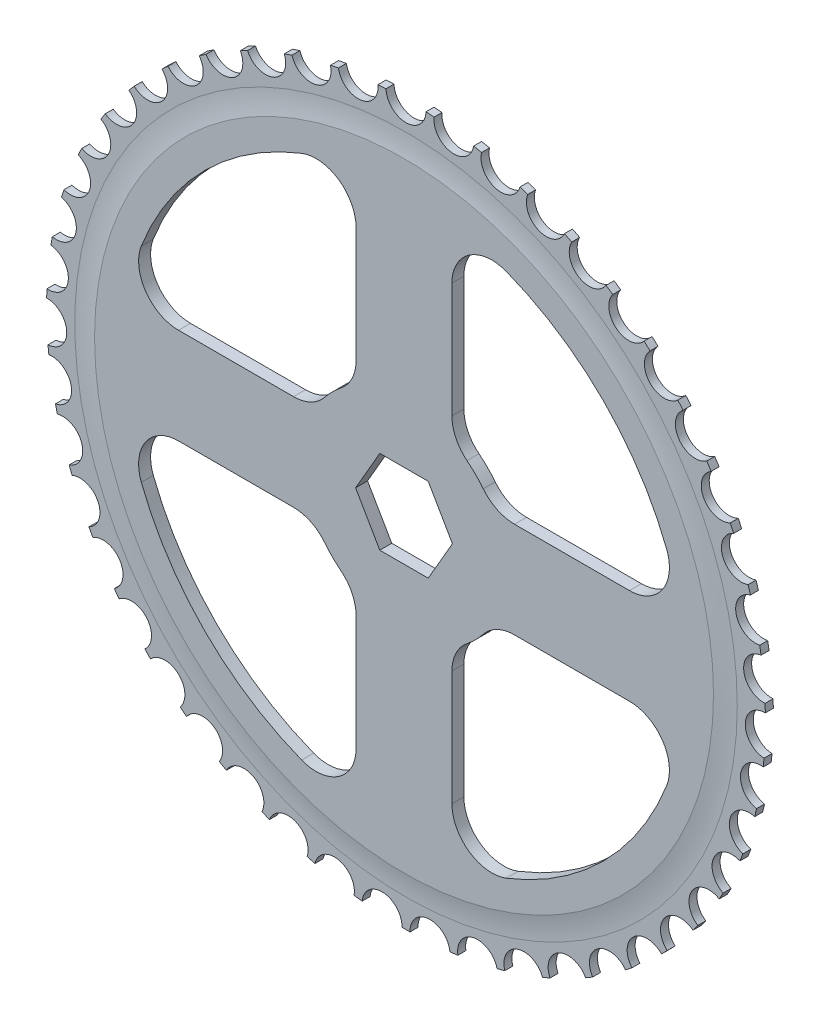
from build123d import *

# Parameters (mm, degrees)
BOSS_EXTRUDE1_DEPTH  = 1.5
CUT_EXTRUDE1_DEPTH   = 128.29897743
SKETCH3_R            = 116.459539932
SKETCH3_R_2          = 77.5
CUT_EXTRUDE2_DEPTH   = 0.5
FILLET1_R            = 30
FILLET1_OF_MIRROR1_R = 30


with BuildPart() as part:
    # Sketch1 → Boss-Extrude1 (new, symmetric)
    with BuildSketch(Plane.XY):
        with BuildLine():
            ThreePointArc((-4.998070615, 89.861111111), (-6.011337037, 89.799019076), (-7.023838635, 89.725501898))
            ThreePointArc((-7.023838635, 89.725501898), (-11.329391207, 84.241586493), (-16.930789178, 88.393146668))
            ThreePointArc((-16.930789178, 88.393146668), (-17.926738659, 88.196553453), (-18.920407319, 87.988738978))
            ThreePointArc((-18.920407319, 87.988738978), (-22.456609159, 81.97987988), (-28.561377406, 85.347804428))
            ThreePointArc((-28.561377406, 85.347804428), (-29.522237206, 85.020218245), (-30.479340886, 84.681814926))
            ThreePointArc((-30.479340886, 84.681814926), (-33.183088389, 78.255240367), (-39.682287178, 80.779428596))
            ThreePointArc((-39.682287178, 80.779428596), (-40.590910729, 80.326695227), (-41.494369893, 79.863741881))
            ThreePointArc((-41.494369893, 79.863741881), (-43.31741462, 73.134134237), (-50.095065595, 74.769541948))
            ThreePointArc((-50.095065595, 74.769541948), (-50.93523849, 74.199740431), (-51.768930886, 73.620498469))
            ThreePointArc((-51.768930886, 73.620498469), (-52.678740562, 66.707947749), (-59.61389638, 67.425391052))
            ThreePointArc((-59.61389638, 67.425391052), (-60.370625713, 66.748689508), (-61.119674081, 66.063495519))
            ThreePointArc((-61.119674081, 66.063495519), (-61.10001313, 59.091356352), (-68.068915771, 58.878032455))
            ThreePointArc((-68.068915771, 58.878032455), (-68.728697689, 58.10650664), (-69.379735245, 57.327587926))
            ThreePointArc((-69.379735245, 57.327587926), (-68.430954516, 50.420278302), (-75.309243748, 49.279993974))
            ThreePointArc((-75.309243748, 49.279993974), (-75.860304428, 48.427411785), (-76.401713389, 47.568668168))
            ThreePointArc((-76.401713389, 47.568668168), (-74.540743898, 40.849449191), (-81.205676486, 38.802552833))
            ThreePointArc((-81.205676486, 38.802552833), (-81.638182236, 37.884128619), (-82.060301147, 36.9608844))
            ThreePointArc((-82.060301147, 36.9608844), (-79.320351939, 30.549660691), (-85.652992004, 27.632679218))
            ThreePointArc((-85.652992004, 27.632679218), (-85.959224749, 26.66480228), (-86.254520888, 25.693532774))
            ThreePointArc((-86.254520888, 25.693532774), (-82.68448642, 19.704712773), (-88.57182785, 15.969699788))
            ThreePointArc((-88.57182785, 15.969699788), (-88.746322859, 14.969641912), (-88.90952666, 13.967679447))
            ThreePointArc((-88.90952666, 13.967679447), (-84.573114283, 8.508133788), (-89.91009733, 4.021740686))
            ThreePointArc((-89.91009733, 4.021740686), (-89.949740736, 3.007347931), (-89.977939822, 1.99257255))
            ThreePointArc((-89.977939822, 1.99257255), (-84.952532917, -2.840273046), (-89.643918993, -7.997986473))
            ThreePointArc((-89.643918993, -7.997986473), (-89.548003358, -9.008612246), (-89.440694517, -10.018091852))
            ThreePointArc((-89.440694517, -10.018091852), (-83.815971589, -14.13799514), (-87.778042798, -19.874989374))
            ThreePointArc((-87.778042798, -19.874989374), (-87.548279739, -20.863813524), (-87.307377899, -21.849983167))
            ThreePointArc((-87.307377899, -21.849983167), (-81.183712263, -25.183424375), (-84.345765349, -31.397322619))
            ThreePointArc((-84.345765349, -31.397322619), (-83.986254994, -32.346699555), (-83.616059054, -33.291961016))
            ThreePointArc((-83.616059054, -33.291961016), (-77.102727667, -35.779454806), (-79.40833572, -42.359369899))
            ThreePointArc((-79.40833572, -42.359369899), (-78.925493539, -43.252357967), (-78.432609654, -44.139843031))
            ThreePointArc((-78.432609654, -44.139843031), (-71.64584307, -45.737000019), (-73.053862458, -52.565513218))
            ThreePointArc((-73.053862458, -52.565513218), (-72.456304781, -53.386177026), (-71.849528478, -54.200048501))
            ThreePointArc((-71.849528478, -54.200048501), (-64.910436707, -54.878367382), (-65.395741291, -61.833623709))
            ThreePointArc((-65.395741291, -61.833623709), (-64.694131549, -62.567318491), (-63.984290763, -63.293052822))
            ThreePointArc((-63.984290763, -63.293052822), (-57.016702062, -63.04042898), (-56.570631571, -69.99831172))
            ThreePointArc((-56.570631571, -69.99831172), (-55.777490006, -70.631944675), (-54.977251864, -71.256591116))
            ThreePointArc((-54.977251864, -71.256591116), (-48.105503018, -70.077532629), (-46.73601759, -76.913878201))
            ThreePointArc((-46.73601759, -76.913878201), (-45.865497833, -77.436142133), (-44.989142602, -77.948553854))
            ThreePointArc((-44.989142602, -77.948553854), (-38.335860133, -75.864101048), (-36.067398268, -82.456914702))
            ThreePointArc((-36.067398268, -82.456914702), (-35.135034765, -82.858489801), (-34.198201026, -83.249522801))
            ThreePointArc((-34.198201026, -83.249522801), (-27.882112916, -80.296872787), (-24.755155369, -86.528505607))
            ThreePointArc((-24.755155369, -86.528505607), (-23.777586168, -86.802225755), (-22.796991741, -87.064902042))
            ThreePointArc((-22.796991741, -87.064902042), (-16.930808734, -83.296744928), (-13.001156137, -89.05599328))
            ThreePointArc((-13.001156137, -89.05599328), (-11.995825984, -89.196973934), (-10.988969599, -89.326606043))
            ThreePointArc((-10.988969599, -89.326606043), (-5.677373868, -84.810184683), (-1.015150965, -89.994274643))
            ThreePointArc((-1.015150965, -89.994274643), (0, -90), (1.015150965, -89.994274643))
            ThreePointArc((1.015150965, -89.994274643), (5.677373868, -84.810184683), (10.988969599, -89.326606043))
            ThreePointArc((10.988969599, -89.326606043), (11.995825984, -89.196973934), (13.001156137, -89.05599328))
            ThreePointArc((13.001156137, -89.05599328), (16.930808734, -83.296744928), (22.796991741, -87.064902042))
            ThreePointArc((22.796991741, -87.064902042), (23.777586168, -86.802225755), (24.755155369, -86.528505607))
            ThreePointArc((24.755155369, -86.528505607), (27.882112916, -80.296872787), (34.198201026, -83.249522801))
            ThreePointArc((34.198201026, -83.249522801), (35.135034765, -82.858489801), (36.067398268, -82.456914702))
            ThreePointArc((36.067398268, -82.456914702), (38.335860133, -75.864101048), (44.989142602, -77.948553854))
            ThreePointArc((44.989142602, -77.948553854), (45.865497833, -77.436142133), (46.73601759, -76.913878201))
            ThreePointArc((46.73601759, -76.913878201), (48.105503018, -70.077532629), (54.977251864, -71.256591116))
            ThreePointArc((54.977251864, -71.256591116), (55.777490006, -70.631944675), (56.570631571, -69.99831172))
            ThreePointArc((56.570631571, -69.99831172), (57.016702062, -63.04042898), (63.984290763, -63.293052822))
            ThreePointArc((63.984290763, -63.293052822), (64.694131549, -62.567318491), (65.395741291, -61.833623709))
            ThreePointArc((65.395741291, -61.833623709), (64.910436707, -54.878367382), (71.849528478, -54.200048501))
            ThreePointArc((71.849528478, -54.200048501), (72.456304781, -53.386177026), (73.053862458, -52.565513218))
            ThreePointArc((73.053862458, -52.565513218), (71.64584307, -45.737000019), (78.432609654, -44.139843031))
            ThreePointArc((78.432609654, -44.139843031), (78.925493539, -43.252357967), (79.40833572, -42.359369899))
            ThreePointArc((79.40833572, -42.359369899), (77.102727667, -35.779454806), (83.616059054, -33.291961016))
            ThreePointArc((83.616059054, -33.291961016), (83.986254994, -32.346699555), (84.345765349, -31.397322619))
            ThreePointArc((84.345765349, -31.397322619), (81.183712263, -25.183424375), (87.307377899, -21.849983167))
            ThreePointArc((87.307377899, -21.849983167), (87.548279739, -20.863813524), (87.778042798, -19.874989374))
            ThreePointArc((87.778042798, -19.874989374), (83.815971589, -14.13799514), (89.440694517, -10.018091852))
            ThreePointArc((89.440694517, -10.018091852), (89.548003358, -9.008612246), (89.643918993, -7.997986473))
            ThreePointArc((89.643918993, -7.997986473), (84.952532917, -2.840273046), (89.977939822, 1.99257255))
            ThreePointArc((89.977939822, 1.99257255), (89.949740736, 3.007347931), (89.91009733, 4.021740686))
            ThreePointArc((89.91009733, 4.021740686), (84.573114283, 8.508133788), (88.90952666, 13.967679447))
            ThreePointArc((88.90952666, 13.967679447), (88.746322859, 14.969641912), (88.57182785, 15.969699788))
            ThreePointArc((88.57182785, 15.969699788), (82.68448642, 19.704712773), (86.254520888, 25.693532774))
            ThreePointArc((86.254520888, 25.693532774), (85.959224749, 26.66480228), (85.652992004, 27.632679218))
            ThreePointArc((85.652992004, 27.632679218), (79.320351939, 30.549660691), (82.060301147, 36.9608844))
            ThreePointArc((82.060301147, 36.9608844), (81.638182236, 37.884128619), (81.205676486, 38.802552833))
            ThreePointArc((81.205676486, 38.802552833), (74.540743898, 40.849449191), (76.401713389, 47.568668168))
            ThreePointArc((76.401713389, 47.568668168), (75.860304428, 48.427411785), (75.309243748, 49.279993974))
            ThreePointArc((75.309243748, 49.279993974), (68.430954516, 50.420278302), (69.379735245, 57.327587926))
            ThreePointArc((69.379735245, 57.327587926), (68.728697689, 58.10650664), (68.068915771, 58.878032455))
            ThreePointArc((68.068915771, 58.878032455), (61.10001313, 59.091356352), (61.119674081, 66.063495519))
            ThreePointArc((61.119674081, 66.063495519), (60.370625713, 66.748689508), (59.61389638, 67.425391052))
            ThreePointArc((59.61389638, 67.425391052), (52.678740562, 66.707947749), (51.768930886, 73.620498469))
            ThreePointArc((51.768930886, 73.620498469), (50.93523849, 74.199740431), (50.095065595, 74.769541948))
            ThreePointArc((50.095065595, 74.769541948), (43.31741462, 73.134134237), (41.494369893, 79.863741881))
            ThreePointArc((41.494369893, 79.863741881), (40.590910729, 80.326695227), (39.682287178, 80.779428596))
            ThreePointArc((39.682287178, 80.779428596), (33.183088389, 78.255240367), (30.479340886, 84.681814926))
            ThreePointArc((30.479340886, 84.681814926), (29.522237206, 85.020218245), (28.561377406, 85.347804428))
            ThreePointArc((28.561377406, 85.347804428), (22.456609159, 81.97987988), (18.920407319, 87.988738978))
            ThreePointArc((18.920407319, 87.988738978), (17.926738659, 88.196553453), (16.930789178, 88.393146668))
            ThreePointArc((16.930789178, 88.393146668), (11.329391207, 84.241586493), (7.023838635, 89.725501898))
            ThreePointArc((7.023838635, 89.725501898), (6.011337037, 89.799019076), (4.998070615, 89.861111111))
            ThreePointArc((4.998070615, 89.861111111), (0, 85), (-4.998070615, 89.861111111))
        make_face()
        Polygon((6.062177826, 10.5), (-6.062177826, 10.5), (-12.124355653, 0), (-6.062177826, -10.5), (6.062177826, -10.5), (12.124355653, 0), align=None, mode=Mode.SUBTRACT)
    extrude(amount=BOSS_EXTRUDE1_DEPTH, both=True)

    # Sketch2 → Cut-Extrude1 (cut, through all)
    with BuildSketch(Plane.XY.offset(1.5)):
        with BuildLine():
            Line((-56.462541902, 12), (-27.670818767, 12))
            ThreePointArc((-27.670818767, 12), (-23.325333021, 12.993516023), (-19.843309218, 15.776649274))
            ThreePointArc((-19.843309218, 15.776649274), (-17.925674088, 17.925674088), (-15.776649274, 19.843309218))
            ThreePointArc((-15.776649274, 19.843309218), (-12.993516023, 23.325333021), (-12, 27.670818767))
            Line((-12, 27.670818767), (-12, 56.462541902))
            ThreePointArc((-12, 56.462541902), (-16.356655148, 64.718004269), (-25.630531777, 65.780226111))
            ThreePointArc((-25.630531777, 65.780226111), (-49.919747127, 49.919747127), (-65.780226111, 25.630531777))
            ThreePointArc((-65.780226111, 25.630531777), (-64.718004269, 16.356655148), (-56.462541902, 12))
        make_face()
        with BuildLine():
            ThreePointArc((12, 56.462541902), (16.356655148, 64.718004269), (25.630531777, 65.780226111))
            ThreePointArc((25.630531777, 65.780226111), (49.919747127, 49.919747127), (65.780226111, 25.630531777))
            ThreePointArc((65.780226111, 25.630531777), (64.718004269, 16.356655148), (56.462541902, 12))
            Line((56.462541902, 12), (27.670818767, 12))
            ThreePointArc((27.670818767, 12), (23.325333021, 12.993516023), (19.843309218, 15.776649274))
            ThreePointArc((19.843309218, 15.776649274), (17.925674088, 17.925674088), (15.776649274, 19.843309218))
            ThreePointArc((15.776649274, 19.843309218), (12.993516023, 23.325333021), (12, 27.670818767))
            Line((12, 27.670818767), (12, 56.462541902))
        make_face()
        with BuildLine():
            Line((56.462541902, -12), (27.670818767, -12))
            ThreePointArc((27.670818767, -12), (23.325333021, -12.993516023), (19.843309218, -15.776649274))
            ThreePointArc((19.843309218, -15.776649274), (17.925674088, -17.925674088), (15.776649274, -19.843309218))
            ThreePointArc((15.776649274, -19.843309218), (12.993516023, -23.325333021), (12, -27.670818767))
            Line((12, -27.670818767), (12, -56.462541902))
            ThreePointArc((12, -56.462541902), (16.356655148, -64.718004269), (25.630531777, -65.780226111))
            ThreePointArc((25.630531777, -65.780226111), (49.919747127, -49.919747127), (65.780226111, -25.630531777))
            ThreePointArc((65.780226111, -25.630531777), (64.718004269, -16.356655148), (56.462541902, -12))
        make_face()
        with BuildLine():
            Line((-56.462541902, -12), (-27.670818767, -12))
            ThreePointArc((-27.670818767, -12), (-23.325333021, -12.993516023), (-19.843309218, -15.776649274))
            ThreePointArc((-19.843309218, -15.776649274), (-17.925674088, -17.925674088), (-15.776649274, -19.843309218))
            ThreePointArc((-15.776649274, -19.843309218), (-12.993516023, -23.325333021), (-12, -27.670818767))
            Line((-12, -27.670818767), (-12, -56.462541902))
            ThreePointArc((-12, -56.462541902), (-16.356655148, -64.718004269), (-25.630531777, -65.780226111))
            ThreePointArc((-25.630531777, -65.780226111), (-49.919747127, -49.919747127), (-65.780226111, -25.630531777))
            ThreePointArc((-65.780226111, -25.630531777), (-64.718004269, -16.356655148), (-56.462541902, -12))
        make_face()
    extrude(amount=-CUT_EXTRUDE1_DEPTH, mode=Mode.SUBTRACT)

    # Sketch3 → Cut-Extrude2 (cut)
    with BuildSketch(Plane.XY.offset(1.5)):
        Circle(SKETCH3_R)
        Circle(SKETCH3_R_2, mode=Mode.SUBTRACT)
    cut_extrude2 = extrude(amount=-CUT_EXTRUDE2_DEPTH, mode=Mode.SUBTRACT)

    # Fillet1
    # the kernel refuses this fillet: 30 mm, written as the material it adds along each edge
    with BuildSketch(Plane(origin=(0, 0, 1), x_dir=(1, 0, 0), z_dir=(0, -1, 0))) as fillet1_piece_1:
        with BuildLine():
            CenterArc((82.954356057, 30), FILLET1_R, 259.524686157, 10.475313843)
            Line((77.5, 0.5), (77.390912879, -0.09))
            ThreePointArc((77.390912879, -0.09), (76.9, 0.25), (76.9, 0))
            Line((76.9, 0), (77.5, -0.6))
            Line((77.5, -0.6), (82.954356057, -0.6))
            Line((82.954356057, -0.6), (82.954356057, 0))
        make_face()
    revolve(axis=Axis((0, 0, 1), (0, 0, 1)))

    # Mirror1: Cut-Extrude2 across plane
    add(cut_extrude2.mirror(Plane.XY), mode=Mode.SUBTRACT)

    # Fillet1 of Mirror1
    # the kernel refuses this fillet: 30 mm, written as the material it adds along each edge
    with BuildSketch(Plane(origin=(0, 0, -1), x_dir=(1, 0, 0), z_dir=(0, -1, 0))) as fillet1_of_mirror1_piece_1:
        with BuildLine():
            CenterArc((82.954356057, -30), FILLET1_OF_MIRROR1_R, 90, 10.475313843)
            Line((77.5, -0.5), (77.390912879, 0.09))
            ThreePointArc((77.390912879, 0.09), (76.9, -0.25), (76.9, 0))
            Line((76.9, 0), (77.5, 0.6))
            Line((77.5, 0.6), (82.954356057, 0.6))
            Line((82.954356057, 0.6), (82.954356057, 0))
        make_face()
    revolve(axis=Axis((0, 0, -1), (0, 0, 1)))


solid = part.part
